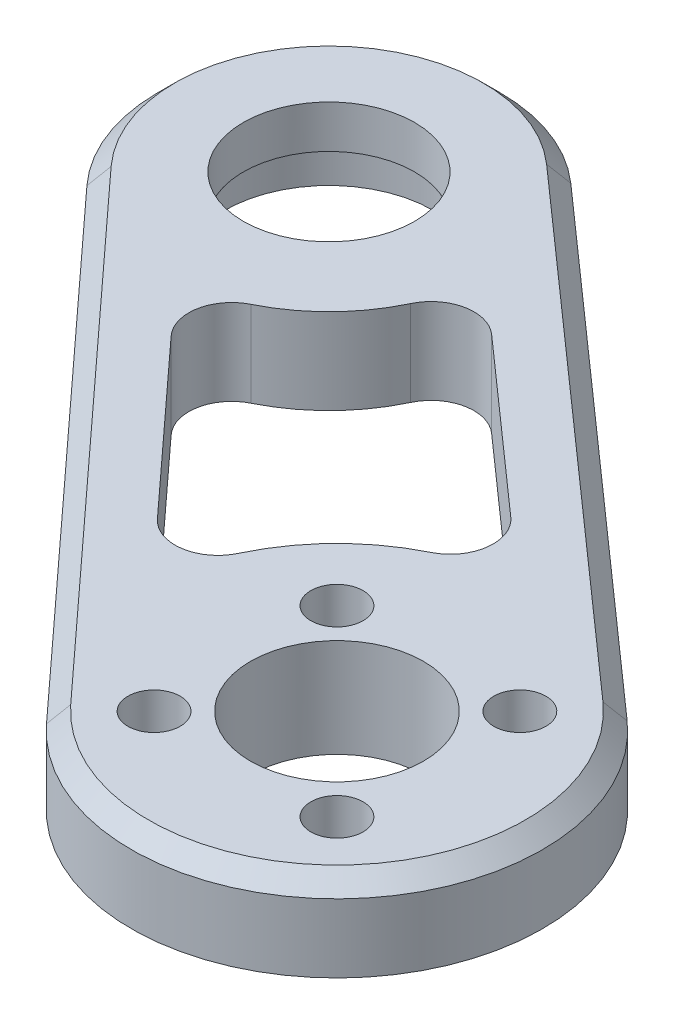
from build123d import *

# Parameters (mm, degrees)
SKETCH1_R              = 10.1
SKETCH1_R_2            = 10
MAIN_BODY_DEPTH        = 10
SKETCH2_R              = 12.2
BEARING_RECESS_DEPTH   = 5
STANDOFF_START         = 1.5
SKETCH3_R              = 21.5
SKETCH3_R_2            = 10.1
STANDOFF_SECTION_DEPTH = 1.5
SKETCH4_R              = 3.05
M6_BOLT_HOLES_DEPTH    = 107.03398004
CHAMFER1_SIZE          = 2


with BuildPart() as part:
    # Sketch1 → Main Body (new body)
    with BuildSketch(Plane(origin=(0, 0, 0), x_dir=(1, 0, 0), z_dir=(0, 1, 0))):
        with BuildLine():
            Line((-69.741518057, 40.551033083), (-17.689821668, -16.219439242))
            ThreePointArc((-17.689821668, -16.219439242), (17.115072934, -16.824811395), (15.914514265, 17.96463848))
            Line((15.914514265, 17.96463848), (-41.737904779, 69.037764518))
            ThreePointArc((-41.737904779, 69.037764518), (-69.262560778, 68.087908614), (-69.741518057, 40.551033083))
        make_face()
        Circle(SKETCH1_R, mode=Mode.SUBTRACT)
        with Locations((-55, 54.067232452)):
            Circle(SKETCH1_R_2, mode=Mode.SUBTRACT)
        with BuildLine():
            Line((-47.625471592, 28.267691162), (-29.927098797, 8.964862385))
            ThreePointArc((-29.927098797, 8.964862385), (-25.488644513, 7.400949716), (-21.717284924, 10.215651499))
            ThreePointArc((-21.717284924, 10.215651499), (-17.115072934, 16.824811395), (-10.585592312, 21.539388))
            ThreePointArc((-10.585592312, 21.539388), (-7.835804554, 25.358336357), (-9.475400239, 29.769393516))
            Line((-9.475400239, 29.769393516), (-29.078104388, 47.135037426))
            ThreePointArc((-29.078104388, 47.135037426), (-33.398420323, 48.290403264), (-36.914902554, 45.527370018))
            ThreePointArc((-36.914902554, 45.527370018), (-40.737439222, 40.046556289), (-46.152073662, 36.130839294))
            ThreePointArc((-46.152073662, 36.130839294), (-48.85455966, 32.56761471), (-47.625471592, 28.267691162))
        make_face(mode=Mode.SUBTRACT)
    extrude(amount=MAIN_BODY_DEPTH)

    # Sketch2 → Bearing Recess (cut)
    with BuildSketch(Plane.XZ):
        with Locations((-55, -54.067232452)):
            Circle(SKETCH2_R)
    extrude(amount=-BEARING_RECESS_DEPTH, mode=Mode.SUBTRACT)

    # Sketch3 → Standoff Section (add)
    with BuildSketch(Plane.XZ.offset(STANDOFF_START)):
        Circle(SKETCH3_R)
        Circle(SKETCH3_R_2, mode=Mode.SUBTRACT)
    extrude(amount=-STANDOFF_SECTION_DEPTH)

    # Sketch4 → M6 Bolt holes (cut, through all)
    with BuildSketch(Plane.XZ.offset(1.5)):
        with Locations((-10.677312396, 10.677312396)):
            Circle(SKETCH4_R)
        with Locations((10.677312396, 10.677312396)):
            Circle(SKETCH4_R)
        with Locations((10.677312396, -10.677312396)):
            Circle(SKETCH4_R)
        with Locations((-10.677312396, -10.677312396)):
            Circle(SKETCH4_R)
    extrude(amount=-M6_BOLT_HOLES_DEPTH, mode=Mode.SUBTRACT)

    # Chamfer1
    chamfer1_edges = [part.edges().sort_by_distance(p)[0] for p in [
        (17.115072934, 10, 16.824811395),
        (-12.911695257, 10, -43.501201499),
        (-43.715669863, 10, -12.16579692),
        (-69.262560778, 10, -68.087908614),
    ]]
    chamfer(chamfer1_edges, length=CHAMFER1_SIZE)


solid = part.part
